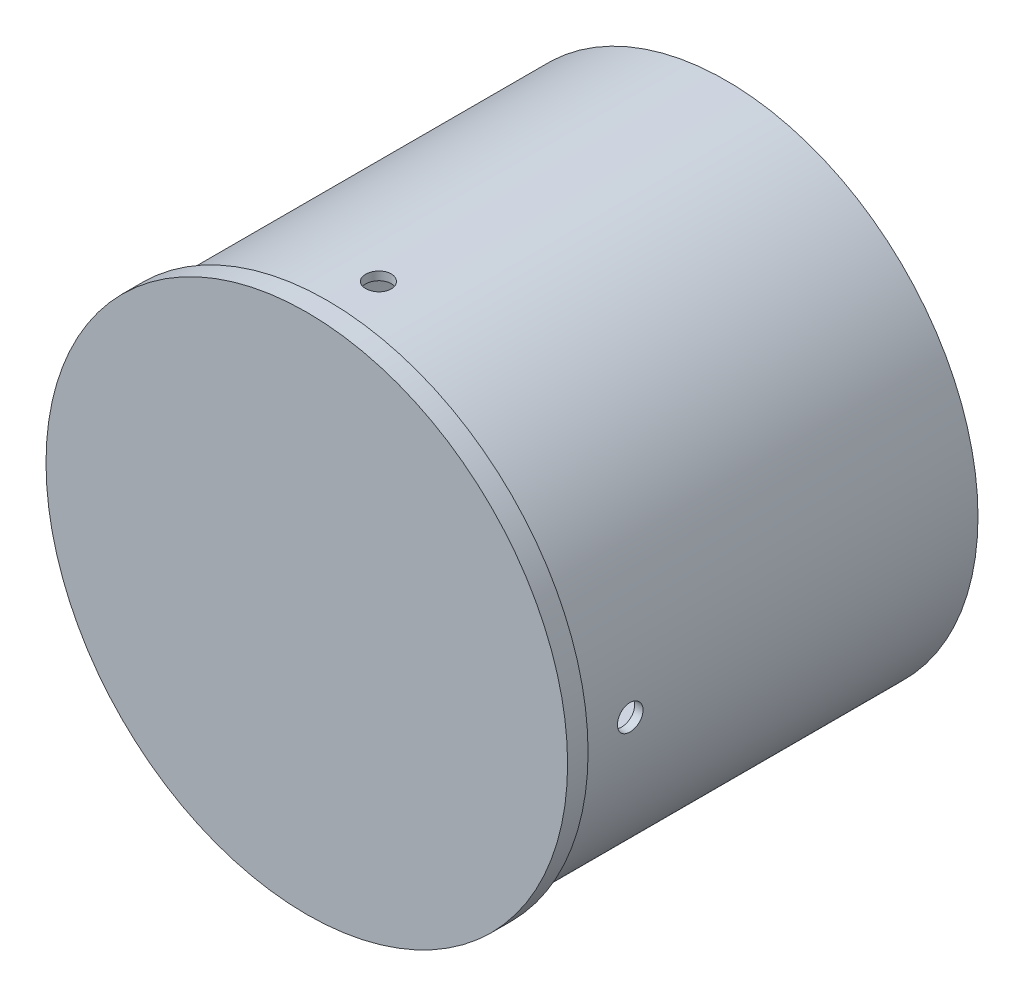
from build123d import *

# Parameters (mm, degrees)
SKETCH1_R               = 49.25
SKETCH1_R_2             = 47.6
BOSS_EXTRUDE1_DEPTH     = 140
SKETCH2_R               = 2.5
CUT_EXTRUDE1_DEPTH      = 20
CIRPATTERN1_COUNT       = 4
MIRROR1_COPY_1_SKETCH_R = 2.5
MIRROR1_COPY_1_DEPTH    = 20
MIRROR1_COPY_2_SKETCH_R = 2.5
MIRROR1_COPY_2_DEPTH    = 20
MIRROR1_COPY_3_SKETCH_R = 2.5
MIRROR1_COPY_3_DEPTH    = 20
SKETCH3_R               = 1.5
CUT_EXTRUDE2_DEPTH      = 157.368555176
CIRPATTERN2_COUNT       = 12
CIRPATTERN2_ANGLE       = 165
SKETCH4_R               = 51
BOSS_EXTRUDE2_DEPTH     = 4
SKETCH7_R               = 55
CUT_EXTRUDE3_DEPTH      = 202


with BuildPart() as part:
    # Sketch1 → Boss-Extrude1 (new, symmetric)
    with BuildSketch(Plane.XY):
        Circle(SKETCH1_R)
        Circle(SKETCH1_R_2, mode=Mode.SUBTRACT)
    extrude(amount=BOSS_EXTRUDE1_DEPTH, both=True)

    # Sketch2 → Cut-Extrude1 (cut)
    with BuildSketch(Plane(origin=(50, 0, 0), x_dir=(0, 0, -1), z_dir=(1, 0, 0))):
        with Locations((-130, 0)):
            Circle(SKETCH2_R)
    cut_extrude1 = extrude(amount=-CUT_EXTRUDE1_DEPTH, mode=Mode.SUBTRACT)

    # CirPattern1: Cut-Extrude1 ×4 about axis
    cirpattern1_axis = Axis((0, 0, 140), (0, 0, 1))
    for i in range(1, CIRPATTERN1_COUNT):
        add(cut_extrude1.rotate(cirpattern1_axis, i * 360 / CIRPATTERN1_COUNT), mode=Mode.SUBTRACT)

    # Mirror1: Cut-Extrude1 across plane
    add(cut_extrude1.mirror(Plane.XY), mode=Mode.SUBTRACT)

    # Mirror1 copy 1 sketch → Mirror1 copy 1 (cut)
    with BuildSketch(Plane.ZX.offset(50)):
        with Locations((-130, 0)):
            Circle(MIRROR1_COPY_1_SKETCH_R)
    extrude(amount=-MIRROR1_COPY_1_DEPTH, mode=Mode.SUBTRACT)

    # Mirror1 copy 2 sketch → Mirror1 copy 2 (cut)
    with BuildSketch(Plane.ZY.offset(50)):
        with Locations((-130, 0)):
            Circle(MIRROR1_COPY_2_SKETCH_R)
    extrude(amount=-MIRROR1_COPY_2_DEPTH, mode=Mode.SUBTRACT)

    # Mirror1 copy 3 sketch → Mirror1 copy 3 (cut)
    with BuildSketch(Plane(origin=(0, -50, 0), x_dir=(0, 0, 1), z_dir=(0, -1, 0))):
        with Locations((-130, 0)):
            Circle(MIRROR1_COPY_3_SKETCH_R)
    extrude(amount=-MIRROR1_COPY_3_DEPTH, mode=Mode.SUBTRACT)

    # Sketch3 → Cut-Extrude2 (cut, through all)
    with BuildSketch(Plane(origin=(0, 0, 0), x_dir=(0, 0, -1), z_dir=(1, 0, 0))):
        with Locations((-110, 30)):
            Circle(SKETCH3_R)
        with Locations((-100, 30)):
            Circle(SKETCH3_R)
        with Locations((-90, 30)):
            Circle(SKETCH3_R)
        with Locations((-80, 30)):
            Circle(SKETCH3_R)
        with Locations((-70, 30)):
            Circle(SKETCH3_R)
        with Locations((-60, 30)):
            Circle(SKETCH3_R)
        with Locations((-50, 30)):
            Circle(SKETCH3_R)
        with Locations((-40, 30)):
            Circle(SKETCH3_R)
        with Locations((-30, 30)):
            Circle(SKETCH3_R)
        with Locations((-20, 30)):
            Circle(SKETCH3_R)
        with Locations((-10, 30)):
            Circle(SKETCH3_R)
        with Locations((0, 30)):
            Circle(SKETCH3_R)
        with Locations((10, 30)):
            Circle(SKETCH3_R)
        with Locations((20, 30)):
            Circle(SKETCH3_R)
        with Locations((30, 30)):
            Circle(SKETCH3_R)
        with Locations((40, 30)):
            Circle(SKETCH3_R)
        with Locations((50, 30)):
            Circle(SKETCH3_R)
        with Locations((60, 30)):
            Circle(SKETCH3_R)
        with Locations((70, 30)):
            Circle(SKETCH3_R)
        with Locations((80, 30)):
            Circle(SKETCH3_R)
    cut_extrude2 = extrude(amount=-CUT_EXTRUDE2_DEPTH, mode=Mode.SUBTRACT)

    # CirPattern2: Cut-Extrude2 ×12 about axis
    cirpattern2_axis = Axis((0, 0, 140), (0, 0, 1))
    for i in range(1, CIRPATTERN2_COUNT):
        add(cut_extrude2.rotate(cirpattern2_axis, i * CIRPATTERN2_ANGLE / (CIRPATTERN2_COUNT - 1)), mode=Mode.SUBTRACT)

    # Sketch4 → Boss-Extrude2 (add)
    with BuildSketch(Plane.XY.offset(140)):
        Circle(SKETCH4_R)
    extrude(amount=BOSS_EXTRUDE2_DEPTH)

    # Sketch7 → Cut-Extrude3 (cut)
    with BuildSketch(Plane.XY.offset(62)):
        Circle(SKETCH7_R)
    extrude(amount=-CUT_EXTRUDE3_DEPTH, mode=Mode.SUBTRACT)


solid = part.part
